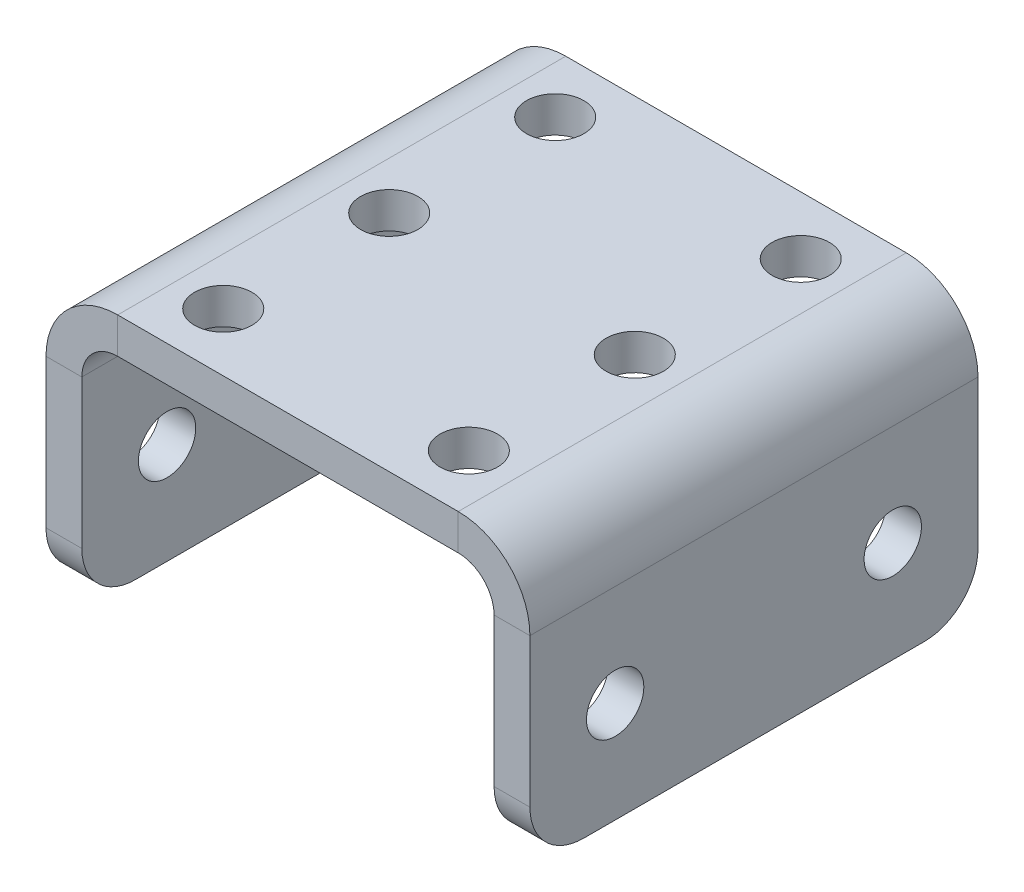
from build123d import *

# Parameters (mm, degrees)
SKETCH_1_W             = 51
SKETCH_1_H             = 25
SM_BASE_FLANGE_3_DEPTH = 2
OTHER_START            = -12.5
OTHER_3_DEPTH          = 25
OTHER_3_2_DEPTH        = 25
OTHER_4_DEPTH          = 25
OTHER_4_2_DEPTH        = 25
SKETCH_20_R            = 1.6
CUT_EXTRUDE_1_DEPTH    = 40
CUT_EXTRUDE_2_DEPTH    = 40
FILLET_1_R             = 3


# Read off the part's stored shape, not the designer's step: 绘制的折弯3, 绘制的折弯4
# Sheet-metal steps are written as plain solids
with BuildPart() as part:
    # 草图1 → 基体-法兰3 (new body)
    with BuildSketch(Plane(origin=(0, 0, 0), x_dir=(1, 0, 0), z_dir=(0, 1, 0))):
        Rectangle(SKETCH_1_W, SKETCH_1_H)
    extrude(amount=-SM_BASE_FLANGE_3_DEPTH)

    # Other 3 outline → Other 3 (cut)
    with BuildSketch(Plane.XY.offset(OTHER_START)):
        with BuildLine():
            Line((-25.5, -2), (-12.964101616, -2))
            ThreePointArc((-12.964101616, -2), (-11.5, -0.535898385), (-9.5, 0))
            Line((-9.5, 0), (-25.5, 0))
            Line((-25.5, 0), (-25.5, -2))
        make_face()
    extrude(amount=OTHER_3_DEPTH, mode=Mode.SUBTRACT)

    # Other 3 2 outline → Other 3 2 (add)
    with BuildSketch(Plane.XY.offset(OTHER_START)):
        with BuildLine():
            Line((-13.5, -15.28761102), (-11.5, -15.28761102))
            Line((-11.5, -15.28761102), (-11.5, -4))
            ThreePointArc((-11.5, -4), (-10.914213562, -2.585786438), (-9.5, -2))
            Line((-9.5, -2), (-12.964101616, -2))
            ThreePointArc((-12.964101616, -2), (-13.363703305, -2.96472382), (-13.5, -4))
            Line((-13.5, -4), (-13.5, -15.28761102))
        make_face()
    extrude(amount=OTHER_3_2_DEPTH)

    # Other 4 outline → Other 4 (cut)
    with BuildSketch(Plane.XY.offset(OTHER_START)):
        with BuildLine():
            ThreePointArc((9.5, 0), (11.5, -0.535898385), (12.964101616, -2))
            Line((12.964101616, -2), (25.5, -2))
            Line((25.5, -2), (25.5, 0))
            Line((25.5, 0), (9.5, 0))
        make_face()
    extrude(amount=OTHER_4_DEPTH, mode=Mode.SUBTRACT)

    # Other 4 2 outline → Other 4 2 (add)
    with BuildSketch(Plane.XY.offset(OTHER_START)):
        with BuildLine():
            Line((11.5, -4), (11.5, -15.28761102))
            Line((11.5, -15.28761102), (13.5, -15.28761102))
            Line((13.5, -15.28761102), (13.5, -4))
            ThreePointArc((13.5, -4), (13.363703305, -2.96472382), (12.964101616, -2))
            Line((12.964101616, -2), (9.5, -2))
            ThreePointArc((9.5, -2), (10.914213562, -2.585786438), (11.5, -4))
        make_face()
    extrude(amount=OTHER_4_2_DEPTH)

    # 草图20 → 切除-拉伸1 (cut)
    with BuildSketch(Plane(origin=(13.5, 0, 0), x_dir=(0, 0, -1), z_dir=(1, 0, 0))):
        with BuildLine():
            Line((-9.345, -9.64380551), (-7.745, -9.64380551))
            Line((-7.745, -9.64380551), (-6.145, -9.64380551))
            ThreePointArc((-6.145, -9.64380551), (-7.745, -8.04380551), (-9.345, -9.64380551))
        make_face()
        with BuildLine():
            Line((-6.145, -9.64380551), (-7.745, -9.64380551))
            Line((-7.745, -9.64380551), (-9.345, -9.64380551))
            ThreePointArc((-9.345, -9.64380551), (-7.745, -11.24380551), (-6.145, -9.64380551))
        make_face()
        with Locations(Location((7.745, -9.64380551, 0), (0, 0, 90))):
            Circle(SKETCH_20_R)
    extrude(amount=-CUT_EXTRUDE_1_DEPTH, mode=Mode.SUBTRACT)

    # 草图21 → 切除-拉伸2 (cut)
    with BuildSketch(Plane.XZ.offset(2)):
        with BuildLine():
            ThreePointArc((-5.25, 9.26), (-5.71862915, 10.39137085), (-6.85, 10.86))
            Line((-6.85, 10.86), (-6.85, 9.26))
            Line((-6.85, 9.26), (-5.25, 9.26))
        make_face()
        with BuildLine():
            Line((-5.25, 9.26), (-6.85, 9.26))
            Line((-6.85, 9.26), (-6.85, 7.66))
            ThreePointArc((-6.85, 7.66), (-5.71862915, 8.12862915), (-5.25, 9.26))
        make_face()
        with BuildLine():
            Line((-6.85, 9.26), (-6.85, 10.86))
            ThreePointArc((-6.85, 10.86), (-8.45, 9.26), (-6.85, 7.66))
            Line((-6.85, 7.66), (-6.85, 9.26))
        make_face()
        with BuildLine():
            Line((6.85, 9.26), (6.85, 10.86))
            ThreePointArc((6.85, 10.86), (5.71862915, 10.39137085), (5.25, 9.26))
            Line((5.25, 9.26), (6.85, 9.26))
        make_face()
        with BuildLine():
            Line((6.85, 7.66), (6.85, 9.26))
            Line((6.85, 9.26), (5.25, 9.26))
            ThreePointArc((5.25, 9.26), (5.71862915, 8.12862915), (6.85, 7.66))
        make_face()
        with BuildLine():
            ThreePointArc((8.45, 9.26), (7.98137085, 10.39137085), (6.85, 10.86))
            Line((6.85, 10.86), (6.85, 9.26))
            Line((6.85, 9.26), (6.85, 7.66))
            ThreePointArc((6.85, 7.66), (7.98137085, 8.12862915), (8.45, 9.26))
        make_face()
        with BuildLine():
            ThreePointArc((8.45, 0), (7.98137085, 1.13137085), (6.85, 1.6))
            Line((6.85, 1.6), (6.85, 0))
            Line((6.85, 0), (6.85, -1.6))
            ThreePointArc((6.85, -1.6), (7.98137085, -1.13137085), (8.45, 0))
        make_face()
        with BuildLine():
            Line((6.85, 0), (6.85, 1.6))
            ThreePointArc((6.85, 1.6), (5.25, 0), (6.85, -1.6))
            Line((6.85, -1.6), (6.85, 0))
        make_face()
        with BuildLine():
            ThreePointArc((-5.25, 0), (-5.71862915, 1.13137085), (-6.85, 1.6))
            Line((-6.85, 1.6), (-6.85, -1.6))
            ThreePointArc((-6.85, -1.6), (-5.71862915, -1.13137085), (-5.25, 0))
        make_face()
        with BuildLine():
            Line((-6.85, -1.6), (-6.85, 1.6))
            ThreePointArc((-6.85, 1.6), (-8.45, 0), (-6.85, -1.6))
        make_face()
        with BuildLine():
            ThreePointArc((-5.25, -9.26), (-5.71862915, -8.12862915), (-6.85, -7.66))
            Line((-6.85, -7.66), (-6.85, -9.26))
            Line((-6.85, -9.26), (-5.25, -9.26))
        make_face()
        with BuildLine():
            Line((-5.25, -9.26), (-6.85, -9.26))
            Line((-6.85, -9.26), (-6.85, -10.86))
            ThreePointArc((-6.85, -10.86), (-5.71862915, -10.39137085), (-5.25, -9.26))
        make_face()
        with BuildLine():
            Line((-6.85, -9.26), (-6.85, -7.66))
            ThreePointArc((-6.85, -7.66), (-8.45, -9.26), (-6.85, -10.86))
            Line((-6.85, -10.86), (-6.85, -9.26))
        make_face()
        with BuildLine():
            ThreePointArc((8.45, -9.26), (7.98137085, -8.12862915), (6.85, -7.66))
            Line((6.85, -7.66), (6.85, -9.26))
            Line((6.85, -9.26), (6.85, -10.86))
            ThreePointArc((6.85, -10.86), (7.98137085, -10.39137085), (8.45, -9.26))
        make_face()
        with BuildLine():
            Line((6.85, -9.26), (6.85, -7.66))
            ThreePointArc((6.85, -7.66), (5.71862915, -8.12862915), (5.25, -9.26))
            Line((5.25, -9.26), (6.85, -9.26))
        make_face()
        with BuildLine():
            Line((6.85, -10.86), (6.85, -9.26))
            Line((6.85, -9.26), (5.25, -9.26))
            ThreePointArc((5.25, -9.26), (5.71862915, -10.39137085), (6.85, -10.86))
        make_face()
    extrude(amount=-CUT_EXTRUDE_2_DEPTH, mode=Mode.SUBTRACT)

    # 圆角1
    fillet_1_edges = [part.edges().sort_by_distance(p)[0] for p in [
        (-12.5, -15.28761102, 12.5),
        (-12.5, -15.28761102, -12.5),
        (12.5, -15.28761102, -12.5),
        (12.5, -15.28761102, 12.5),
    ]]
    fillet(fillet_1_edges, radius=FILLET_1_R)


solid = part.part
